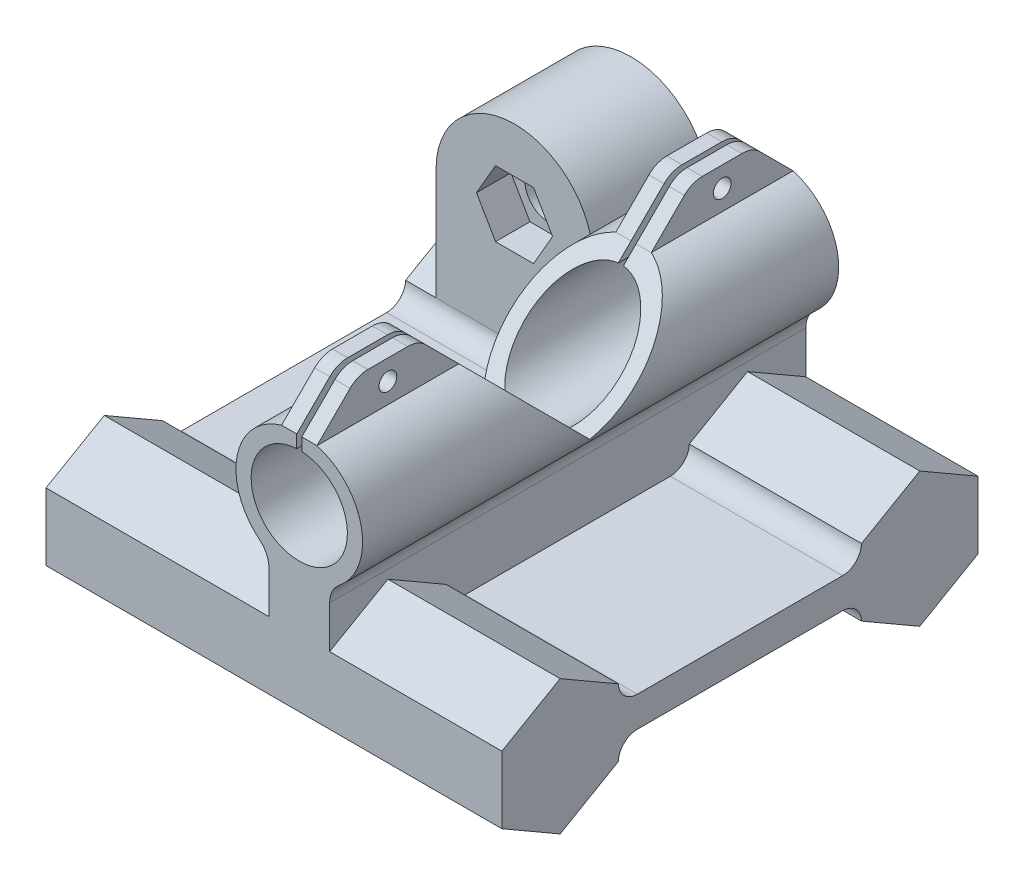
from build123d import *

# Parameters (mm, degrees)
BOSS_EXTRUDE1_DEPTH = 90
FILLET3_R           = 3.75
BOSS_EXTRUDE2_REACH = 132.814
FILLET4_R           = 5
SKETCH5_R           = 4.75
BOSS_EXTRUDE7_DEPTH = 23
CUT_EXTRUDE2_DEPTH  = 6.8
CUT_EXTRUDE3_REACH  = 125.885
SKETCH7_R           = 1.75
CHAMFER1_SIZE       = 8
FILLET5_R           = 5
CUT_EXTRUDE4_START  = -94
SKETCH8_W           = 125.822690829
SKETCH8_H           = 77.860904062
CUT_EXTRUDE4_DEPTH  = 94
SKETCH9_R           = 10
CUT_EXTRUDE5_DEPTH  = 10
SKETCH10_R          = 5
CUT_EXTRUDE6_DEPTH  = 56


# Read off the part's stored shape, not the designer's step: Mirror1
# Some blends are built 0.0001 mm under size
with BuildPart() as part:
    # Sketch2 → Boss-Extrude1 (new body)
    with BuildSketch(Plane(origin=(0, 0, 0), x_dir=(0, 0, -1), z_dir=(1, 0, 0))):
        Polygon((-1.111261719, 3), (46.888738281, 3), (46.888738281, 6.639528096), (58.388738281, 13.279056191), (69.888738281, 6.639528096), (69.888738281, -6.639528096), (58.388738281, -13.279056191), (46.888738281, -6.639528096), (46.888738281, -3), (-1.111261719, -3), (-1.111261719, -6.639528096), (-12.611261719, -13.279056191), (-24.111261719, -6.639528096), (-24.111261719, 6.639528096), (-12.611261719, 13.279056191), (-1.111261719, 6.639528096), align=None)
    extrude(amount=BOSS_EXTRUDE1_DEPTH)

    # Fillet3
    # the kernel refuses this fillet: 3.75 mm, written as the material it adds along each edge
    with BuildSketch(Plane(origin=(0, -3, 1.111261719), x_dir=(0, 0, -1), z_dir=(1, 0, 0)), Plane(origin=(0, 3, -46.888738281), x_dir=(0, 0, 1), z_dir=(1, 0, 0))) as fillet3_piece_1:
        with BuildLine():
            CenterArc((3.748372441, -3.75), FILLET3_R, 90, 88.311869402)
            Line((0, -3.639528096), (-0.074967449, -3.637318658))
            ThreePointArc((-0.074967449, -3.637318658), (-0.075, -1.819764048), (-0.075, 0))
            Line((-0.075, 0), (0, 0.075))
            Line((0, 0.075), (3.748372441, 0.075))
            Line((3.748372441, 0.075), (3.748372441, 0))
        make_face()
    extrude(amount=90)
    with BuildSketch(Plane(origin=(0, -3, -46.888738281), x_dir=(0, -1, 0), z_dir=(1, 0, 0))) as fillet3_piece_2:
        with BuildLine():
            CenterArc((3.75, -3.748372441), FILLET3_R, 91.688130598, 88.311869402)
            Line((0, -3.748372441), (-0.075, -3.748372441))
            Line((-0.075, -3.748372441), (-0.075, 0))
            Line((-0.075, 0), (0, 0.075))
            ThreePointArc((0, 0.075), (1.819764048, 0.075), (3.637318658, 0.074967449))
            Line((3.637318658, 0.074967449), (3.639528096, 0))
        make_face()
    extrude(amount=90)
    with BuildSketch(Plane(origin=(0, 3, 1.111261719), x_dir=(0, 0, -1), z_dir=(1, 0, 0))) as fillet3_piece_3:
        with BuildLine():
            CenterArc((3.748372441, 3.75), FILLET3_R, 181.688130598, 88.311869402)
            Line((0, 3.639528096), (-0.074967449, 3.637318658))
            ThreePointArc((-0.074967449, 3.637318658), (-0.075, 1.819764048), (-0.075, 0))
            Line((-0.075, 0), (0, -0.075))
            Line((0, -0.075), (3.748372441, -0.075))
            Line((3.748372441, -0.075), (3.748372441, 0))
        make_face()
    extrude(amount=90)

    # Boss-Extrude2: up to this face of the body (flat: up to its plane)
    boss_extrude2_end = Plane(part.part.faces().sort_by_distance((45, 0, 24.111261719))[0])
    # Sketch4 → Boss-Extrude2 (add, up to the picked face)
    with BuildSketch(Plane(origin=(0, 0, -69.888738281), x_dir=(-1, 0, 0), z_dir=(0, 0, -1)), mode=Mode.PRIVATE) as boss_extrude2_sk1:
        with BuildLine():
            Line((-46, 3), (-46, 17.64593212))
            ThreePointArc((-46, 17.64593212), (-52.426589902, 29.964512656), (-43.5, 40.611788219))
            Line((-43.5, 40.611788219), (-43.5, 48.611788219))
            Line((-43.5, 48.611788219), (-40.5, 48.611788219))
            Line((-40.5, 48.611788219), (-40.5, 41.101784216))
            Line((-40.5, 41.101784216), (-40.5, 38.0986212))
            ThreePointArc((-40.5, 38.0986212), (-40, 19.111788219), (-39.5, 38.0986212))
            Line((-39.5, 38.0986212), (-39.5, 41.101784216))
            Line((-39.5, 41.101784216), (-39.5, 48.611788219))
            Line((-39.5, 48.611788219), (-36.5, 48.611788219))
            Line((-36.5, 48.611788219), (-36.5, 40.611788219))
            ThreePointArc((-36.5, 40.611788219), (-27.573410098, 29.964512656), (-34, 17.64593212))
            Line((-34, 17.64593212), (-34, 3))
            Line((-34, 3), (-46, 3))
        make_face()
    boss_extrude2_tool1 = split(extrude(boss_extrude2_sk1.sketch, amount=-BOSS_EXTRUDE2_REACH, mode=Mode.PRIVATE), bisect_by=boss_extrude2_end, keep=Keep.BOTH, mode=Mode.PRIVATE)
    add(boss_extrude2_tool1.solids().sort_by(Axis((45.479862, 10.322966, -69.888738), (0, 0, 1)))[0])

    # Fillet4
    fillet4_edges = [part.edges().sort_by_distance(p)[0] for p in [
        (34, 17.64593212, -22.888738281),
        (46, 17.64593212, -22.888738281),
    ]]
    fillet(fillet4_edges, radius=FILLET4_R)

    # Sketch5 → Boss-Extrude7 (add)
    with BuildSketch(Plane(origin=(0, 0, -69.888738281), x_dir=(-1, 0, 0), z_dir=(0, 0, -1))):
        with BuildLine():
            Line((-84, 28.611788219), (-84, 6.639528096))
            Line((-84, 6.639528096), (-53, 6.639528096))
            Line((-53, 6.639528096), (-53, 28.611788219))
            ThreePointArc((-53, 28.611788219), (-68.5, 44.111788219), (-84, 28.611788219))
        make_face()
        with Locations((-68.5, 28.611788219)):
            Circle(SKETCH5_R, mode=Mode.SUBTRACT)
    extrude(amount=-BOSS_EXTRUDE7_DEPTH)

    # Sketch6 → Cut-Extrude2 (cut)
    with BuildSketch(Plane.XY.offset(-46.888738281)):
        Polygon((60.994446501, 28.611788219), (64.74722325, 22.111788219), (72.25277675, 22.111788219), (76.005553499, 28.611788219), (72.25277675, 35.111788219), (64.74722325, 35.111788219), align=None)
    extrude(amount=-CUT_EXTRUDE2_DEPTH, mode=Mode.SUBTRACT)

    # Cut-Extrude3: up to this face of the body (flat: up to its plane)
    cut_extrude3_end = Plane(part.part.faces().sort_by_distance((53, 19.187065128, -58.388738281))[0])
    # Sketch7 → Cut-Extrude3 (cut, up to the picked face)
    with BuildSketch(Plane.ZY, mode=Mode.PRIVATE) as cut_extrude3_sk1:
        with Locations((10.111261719, 44.611788219)):
            Circle(SKETCH7_R)
    cut_extrude3_tool1 = split(extrude(cut_extrude3_sk1.sketch, amount=-CUT_EXTRUDE3_REACH, mode=Mode.PRIVATE), bisect_by=cut_extrude3_end, keep=Keep.BOTH, mode=Mode.PRIVATE)
    # Sketch7 → Cut-Extrude3 (cut, up to the picked face)
    with BuildSketch(Plane.ZY, mode=Mode.PRIVATE) as cut_extrude3_sk2:
        with Locations((-55.888738281, 44.611788219)):
            Circle(SKETCH7_R)
    cut_extrude3_tool2 = split(extrude(cut_extrude3_sk2.sketch, amount=-CUT_EXTRUDE3_REACH, mode=Mode.PRIVATE), bisect_by=cut_extrude3_end, keep=Keep.BOTH, mode=Mode.PRIVATE)
    # Sketch7 → Cut-Extrude3 (cut, up to the picked face)
    with BuildSketch(Plane.ZY, mode=Mode.PRIVATE) as cut_extrude3_sk3:
        Polygon((-41.888738281, 40.611788219), (-22.888738281, 21.611788219), (-3.888738281, 40.611788219), (-3.888738281, 48.611788219), (-41.888738281, 48.611788219), align=None)
    cut_extrude3_tool3 = split(extrude(cut_extrude3_sk3.sketch, amount=-CUT_EXTRUDE3_REACH, mode=Mode.PRIVATE), bisect_by=cut_extrude3_end, keep=Keep.BOTH, mode=Mode.PRIVATE)
    add(cut_extrude3_tool1.solids().sort_by(Axis((0, 44.611788, 10.111262), (1, 0, 0)))[0], mode=Mode.SUBTRACT)
    add(cut_extrude3_tool2.solids().sort_by(Axis((0, 44.611788, -55.888738), (1, 0, 0)))[0], mode=Mode.SUBTRACT)
    add(cut_extrude3_tool3.solids().sort_by(Axis((0, 39.002264, -22.888738), (1, 0, 0)))[0], mode=Mode.SUBTRACT)

    # Chamfer1
    chamfer1_edges = [part.edges().sort_by_distance(p)[0] for p in [
        (42, 48.611788219, -41.888738281),
        (42, 48.611788219, -69.888738281),
        (42, 48.611788219, -3.888738281),
        (42, 48.611788219, 24.111261719),
        (38, 48.611788219, -41.888738281),
        (38, 48.611788219, -69.888738281),
        (38, 48.611788219, -3.888738281),
        (38, 48.611788219, 24.111261719),
    ]]
    chamfer(chamfer1_edges, length=CHAMFER1_SIZE - 0.0001)  # a hair under: the kernel refuses the full size

    # Fillet5
    fillet5_edges = [part.edges().sort_by_distance(p)[0] for p in [
        (42, 48.611788219, -49.888638281),
        (42, 48.611788219, -61.888838281),
        (38, 48.611788219, -49.888638281),
        (38, 48.611788219, -61.888838281),
        (42, 48.611788219, 16.111361719),
        (42, 48.611788219, 4.111161719),
        (38, 48.611788219, 16.111361719),
        (38, 48.611788219, 4.111161719),
    ]]
    fillet(fillet5_edges, radius=FILLET5_R)

    # Mirror1: part across plane


with BuildPart() as part_1:
    add(part.part)
    add(part.part.mirror(Plane.ZY.offset(-90)))

    # Sketch8 → Cut-Extrude4 (cut)
    with BuildSketch(Plane.XY.offset(24.111261719).offset(CUT_EXTRUDE4_START)):
        with Locations((27.088654585, 25.65139584)):
            Rectangle(SKETCH8_W, SKETCH8_H)
    extrude(amount=CUT_EXTRUDE4_DEPTH, mode=Mode.SUBTRACT)

    # Sketch9 → Cut-Extrude5 (cut)
    with BuildSketch(Plane.XZ.offset(3)):
        with Locations(Location((106, -22.888738281, 0), (0, 0, 270))):
            Circle(SKETCH9_R)
    extrude(amount=-CUT_EXTRUDE5_DEPTH, mode=Mode.SUBTRACT)

    # Sketch10 → Cut-Extrude6 (cut)
    with BuildSketch(Plane.ZY.offset(-90)):
        with Locations((12.611261719, 0)):
            Circle(SKETCH10_R)
        with Locations((-58.388738281, 0)):
            Circle(SKETCH10_R)
    extrude(amount=-CUT_EXTRUDE6_DEPTH, mode=Mode.SUBTRACT)


solid = part_1.part
